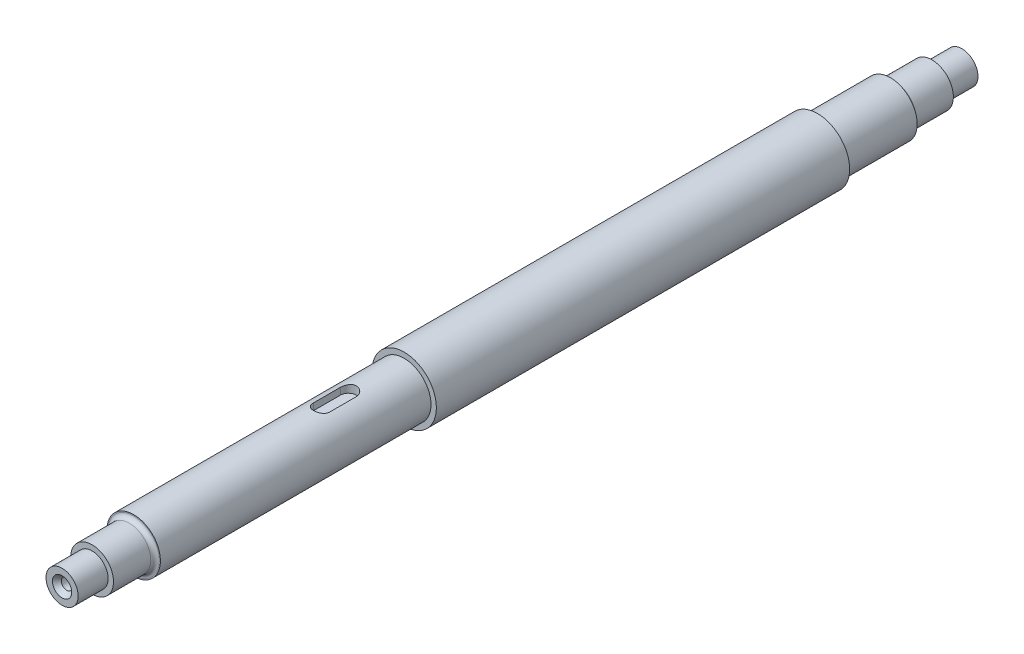
from build123d import *

# Parameters (mm, degrees)
SKETCH1_R            = 9.525
BOSS_EXTRUDE1_DEPTH  = 139.7
CUT_EXTRUDE1_REACH   = 232.645
SKETCH3_R            = 9.525
SKETCH3_R_2          = 7.9375
CUT_EXTRUDE2_REACH   = 266.503
SKETCH4_R            = 7.9375
SKETCH4_R_2          = 4.7625
SKETCH5_R            = 9.525
SKETCH5_R_2          = 7.9375
CUT_EXTRUDE3_DEPTH   = 58.6105
CUT_EXTRUDE4_DEPTH   = 2.38125
SKETCH7_R            = 7.9375
SKETCH7_R_2          = 6.35
CUT_EXTRUDE5_DEPTH   = 12.319
FILLET1_R            = 1.27
SKETCH8_R            = 4.7625
CUT_EXTRUDE6_DEPTH   = 6.35
FILLET1_OF_MIRROR3_R = 1.27


with BuildPart() as part:
    # Sketch1 → Boss-Extrude1 (new, symmetric)
    with BuildSketch(Plane.XY):
        Circle(SKETCH1_R)
    extrude(amount=BOSS_EXTRUDE1_DEPTH, both=True)

    # Sketch3 → Cut-Extrude1 (cut, up to next)
    with BuildSketch(Plane.XY.offset(90.551), mode=Mode.PRIVATE) as cut_extrude1_sk1:
        Circle(SKETCH3_R)
        Circle(SKETCH3_R_2, mode=Mode.SUBTRACT)
    cut_extrude1_tool1 = extrude(cut_extrude1_sk1.sketch, amount=CUT_EXTRUDE1_REACH, mode=Mode.PRIVATE) & part.part
    cut_extrude1 = cut_extrude1_tool1.solids().sort_by_distance((-9.255592, 0, 90.551))[0]
    add(cut_extrude1, mode=Mode.SUBTRACT)

    # Mirror1: Cut-Extrude1 across plane
    add(cut_extrude1.mirror(Plane.XY), mode=Mode.SUBTRACT)

    # Sketch4 → Cut-Extrude2 (cut, up to next)
    with BuildSketch(Plane.XY.offset(124.46), mode=Mode.PRIVATE) as cut_extrude2_sk1:
        Circle(SKETCH4_R)
        Circle(SKETCH4_R_2, mode=Mode.SUBTRACT)
    cut_extrude2_tool1 = extrude(cut_extrude2_sk1.sketch, amount=CUT_EXTRUDE2_REACH, mode=Mode.PRIVATE) & part.part
    cut_extrude2 = cut_extrude2_tool1.solids().sort_by_distance((-7.712994, 0, 124.46))[0]
    add(cut_extrude2, mode=Mode.SUBTRACT)

    # Mirror2: Cut-Extrude2 across plane
    add(cut_extrude2.mirror(Plane.XY), mode=Mode.SUBTRACT)

    # Sketch5 → Cut-Extrude3 (cut)
    with BuildSketch(Plane.XY.offset(90.551)):
        Circle(SKETCH5_R)
        Circle(SKETCH5_R_2, mode=Mode.SUBTRACT)
    extrude(amount=-CUT_EXTRUDE3_DEPTH, mode=Mode.SUBTRACT)

    # Sketch6 → Cut-Extrude4 (cut)
    with BuildSketch(Plane(origin=(0, 7.9375, 0), x_dir=(1, 0, 0), z_dir=(0, 1, 0))):
        with BuildLine():
            Line((-2.38125, -48.48225), (-2.38125, -56.41975))
            ThreePointArc((-2.38125, -56.41975), (0, -58.801), (2.38125, -56.41975))
            Line((2.38125, -56.41975), (2.38125, -48.48225))
            ThreePointArc((2.38125, -48.48225), (0, -46.101), (-2.38125, -48.48225))
        make_face()
    extrude(amount=-CUT_EXTRUDE4_DEPTH, mode=Mode.SUBTRACT)

    # Sketch7 → Cut-Extrude5 (cut)
    with BuildSketch(Plane.XY.offset(124.46)):
        Circle(SKETCH7_R)
        Circle(SKETCH7_R_2, mode=Mode.SUBTRACT)
    cut_extrude5 = extrude(amount=-CUT_EXTRUDE5_DEPTH, mode=Mode.SUBTRACT)

    # Fillet1
    fillet1_edges = [part.edges().sort_by_distance(p)[0] for p in [
        (-6.35, 0, 112.141),
    ]]
    fillet(fillet1_edges, radius=FILLET1_R)

    # Sketch8 → Cut-Extrude6 (cut)
    with BuildSketch(Plane.XY.offset(139.7)):
        Circle(SKETCH8_R)
    cut_extrude6 = extrude(amount=-CUT_EXTRUDE6_DEPTH, mode=Mode.SUBTRACT)

    # Sketch10 → CSK for #4 Flat Head Machine Screw1 (revolve, cut)
    with BuildSketch(Plane(origin=(0, 0, 133.35), x_dir=(0, -1, 0), z_dir=(1, 0, 0))):
        Polygon((0, 0), (0, 7.330574487), (1.63195, 6.35), (1.63195, 1.409834001), (2.8575, 0), align=None)
    csk_for_4_flat_head_machine_screw1 = revolve(axis=Axis((0, 0, 139.7), (0, 0, -1)), mode=Mode.SUBTRACT)

    # Mirror3: Cut-Extrude5, Cut-Extrude6, CSK for #4 Flat Head Machine Screw1 across plane
    add(cut_extrude5.mirror(Plane.XY), mode=Mode.SUBTRACT)
    add(cut_extrude6.mirror(Plane.XY), mode=Mode.SUBTRACT)
    add(csk_for_4_flat_head_machine_screw1.mirror(Plane.XY), mode=Mode.SUBTRACT)

    # Fillet1 of Mirror3
    fillet1_of_mirror3_edges = [part.edges().sort_by_distance(p)[0] for p in [
        (-6.35, 0, -112.141),
    ]]
    fillet(fillet1_of_mirror3_edges, radius=FILLET1_OF_MIRROR3_R)


solid = part.part
